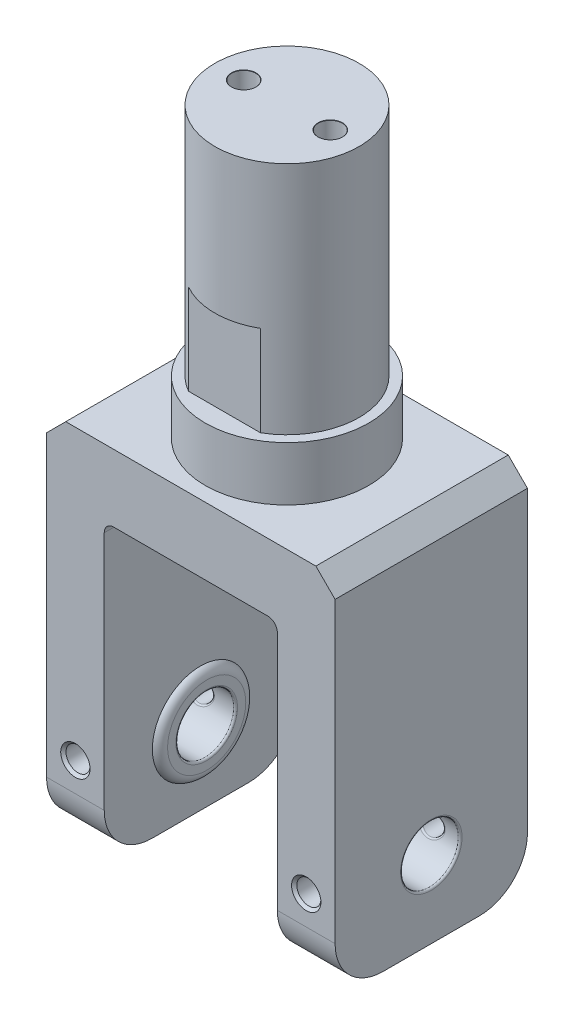
from build123d import *

# Parameters (mm, degrees)
SKETCH_1_W                   = 30
SKETCH_1_H                   = 20
EXTRUDE_1_DEPTH              = 40
SKETCH_2_W                   = 18
SKETCH_2_H                   = 34
CUT_EXTRUDE_1_DEPTH          = 48.16990566
SKETCH_3_R                   = 3
CUT_EXTRUDE_2_DEPTH          = 51.990195136
CHAMFER_1_SIZE               = 2
CHAMFER_2_SIZE               = 1
FILLET_1_R                   = 1
EXTRUDE_START                = 0.65
SKETCH_4_R                   = 5
SKETCH_4_R_2                 = 3
EXTRUDE_2_DEPTH              = 0.65
FILLET_2_R                   = 1
FILLET_2_OF_MIRROR_1_R       = 1
SKETCH_5_R                   = 8.5
EXTRUDE_3_DEPTH              = 5.62
SKETCH_6_R                   = 7.5
EXTRUDE_4_DEPTH              = 24.4
HOLE_WIZARD_M3_1_D           = 2.5
HOLE_WIZARD_M3_1_CSINK_D     = 3.05
HOLE_WIZARD_M3_1_CSINK_ANGLE = 90
F_2_5MM_1_D                  = 2.5
F_2_5MM_1_DEPTH              = 8.5
F_2_5MM_1_CSINK_D            = 2.55
F_2_5MM_1_CSINK_ANGLE        = 90
F_2_5MM_1_TIP                = 0.751075774
FILLET_3_R                   = 0.2
CUT_EXTRUDE_START            = -15
SKETCH_13_W                  = 1.859245168
SKETCH_13_H                  = 11.127950351
SKETCH_13_W_2                = 13.010312946
SKETCH_13_H_2                = 5.756908727
CUT_EXTRUDE_3_DEPTH          = 9.4
SKETCH_14_W                  = 47.057083946
SKETCH_14_H                  = 7
CUT_EXTRUDE_4_DEPTH          = 75.349178879
FILLET_5_R                   = 5


with BuildPart() as part:
    # 草图1 → 凸台-拉伸1 (new body)
    with BuildSketch(Plane(origin=(0, 0, 0), x_dir=(1, 0, 0), z_dir=(0, 1, 0))):
        Rectangle(SKETCH_1_W, SKETCH_1_H)
    extrude(amount=EXTRUDE_1_DEPTH)

    # 草图2 → 切除-拉伸1 (cut, through all)
    with BuildSketch(Plane.XY.offset(10)):
        with Locations((0, 16)):
            Rectangle(SKETCH_2_W, SKETCH_2_H)
    extrude(amount=-CUT_EXTRUDE_1_DEPTH, mode=Mode.SUBTRACT)

    # 草图3 → 切除-拉伸2 (cut, through all)
    with BuildSketch(Plane(origin=(15, 0, 0), x_dir=(0, 0, -1), z_dir=(1, 0, 0))):
        with Locations((0, 10)):
            Circle(SKETCH_3_R)
    extrude(amount=-CUT_EXTRUDE_2_DEPTH, mode=Mode.SUBTRACT)

    # 倒角1
    chamfer_1_edges = [part.edges().sort_by_distance(p)[0] for p in [
        (-15, 40, 0),
        (15, 40, 0),
    ]]
    chamfer(chamfer_1_edges, length=CHAMFER_1_SIZE)

    # 倒角2
    chamfer_2_edges = [part.edges().sort_by_distance(p)[0] for p in [
        (9, 0, 0),
        (-9, 0, 0),
        (-15, 0, 0),
        (15, 0, 0),
    ]]
    chamfer(chamfer_2_edges, length=CHAMFER_2_SIZE)

    # 圆角1
    fillet_1_edges = [part.edges().sort_by_distance(p)[0] for p in [
        (-9, 33, 0),
        (9, 33, 0),
    ]]
    fillet(fillet_1_edges, radius=FILLET_1_R)

    # 草图4 → 凸台-拉伸2 (add)
    with BuildSketch(Plane(origin=(-9, 0, 0), x_dir=(0, 0, -1), z_dir=(1, 0, 0)).offset(EXTRUDE_START)):
        with Locations(Location((0, 10, 0), (0, 0, 270))):
            Circle(SKETCH_4_R)
        with Locations((0, 10)):
            Circle(SKETCH_4_R_2, mode=Mode.SUBTRACT)
    extrude_2 = extrude(amount=-EXTRUDE_2_DEPTH)

    # 圆角2
    # the kernel refuses this fillet: 1 mm, written as the material it takes off along each edge
    with BuildSketch(Plane(origin=(-8.35, 10, 0), x_dir=(0, -1, 0), z_dir=(0, 0, 1))) as fillet_2_piece_1:
        with BuildLine():
            CenterArc((4.0632503, -1), FILLET_2_R, 20.487315115, 69.512684885)
            Line((5, -0.65), (5.018734994, -0.643))
            ThreePointArc((5.018734994, -0.643), (5.02, -0.325), (5.02, 0))
            Line((5.02, 0), (5, 0.02))
            Line((5, 0.02), (4.0632503, 0.02))
            Line((4.0632503, 0.02), (4.0632503, 0))
        make_face()
    revolve(axis=Axis((-8.35, 10, 0), (1, 0, 0)), mode=Mode.SUBTRACT)

    # 镜向1: 凸台-拉伸2 across plane
    add(extrude_2.mirror(Plane(origin=(0, 0, 0), x_dir=(0, 0, 1), z_dir=(1, 0, 0))))

    # 圆角2 of 镜向1
    # the kernel refuses this fillet: 1 mm, written as the material it takes off along each edge
    with BuildSketch(Plane(origin=(8.35, 10, 0), x_dir=(0, -1, 0), z_dir=(0, 0, 1))) as fillet_2_of_mirror_1_piece_1:
        with BuildLine():
            CenterArc((4.0632503, 1), FILLET_2_OF_MIRROR_1_R, 270, 69.512684885)
            Line((5, 0.65), (5.018734994, 0.643))
            ThreePointArc((5.018734994, 0.643), (5.02, 0.325), (5.02, 0))
            Line((5.02, 0), (5, -0.02))
            Line((5, -0.02), (4.0632503, -0.02))
            Line((4.0632503, -0.02), (4.0632503, 0))
        make_face()
    revolve(axis=Axis((8.35, 10, 0), (1, 0, 0)), mode=Mode.SUBTRACT)

    # 草图5 → 凸台-拉伸3 (add)
    with BuildSketch(Plane(origin=(0, 40, 0), x_dir=(1, 0, 0), z_dir=(0, 1, 0))):
        with Locations(Location((0, 0, 0), (0, 0, 270))):
            Circle(SKETCH_5_R)
    extrude(amount=EXTRUDE_3_DEPTH)

    # 草图6 → 凸台-拉伸4 (add)
    with BuildSketch(Plane(origin=(0, 45.62, 0), x_dir=(1, 0, 0), z_dir=(0, 1, 0))):
        with Locations(Location((0, 0, 0), (0, 0, 270))):
            Circle(SKETCH_6_R)
    extrude(amount=EXTRUDE_4_DEPTH)

    # M3 螺纹孔1 (through all)
    with Locations(Plane.XY.offset(10)):
        with Locations((-12, 10), (12, 10)):
            CounterSinkHole(HOLE_WIZARD_M3_1_D / 2, HOLE_WIZARD_M3_1_CSINK_D / 2, counter_sink_angle=HOLE_WIZARD_M3_1_CSINK_ANGLE)

    # Ø2.5mm 暗销孔1
    with Locations(Plane(origin=(4.5, 70.02, 0), x_dir=(0, 0, 1), z_dir=(0, 1, 0))):
        with Locations((0, 0), (0, -9)):
            CounterSinkHole(F_2_5MM_1_D / 2, F_2_5MM_1_CSINK_D / 2, depth=F_2_5MM_1_DEPTH, counter_sink_angle=F_2_5MM_1_CSINK_ANGLE)
            with Locations((0, 0, -(F_2_5MM_1_DEPTH + F_2_5MM_1_TIP / 2))):  # 118° drill point
                Cone(0, F_2_5MM_1_D / 2, F_2_5MM_1_TIP, mode=Mode.SUBTRACT)

    # 圆角3
    fillet_3_edges = [part.edges().sort_by_distance(p)[0] for p in [
        (-8.35, 10, 3),
        (8.35, 10, 3),
        (12, 8.75, -2.727178029),
        (13.250000001, 10, 3.000000001),
        (-12, 8.75, -2.727178029),
        (-10.749999999, 10, 3.000000001),
        (-15, 10, 3),
        (15, 10, 3),
    ]]
    fillet(fillet_3_edges, radius=FILLET_3_R)

    # 草图13 → 切除-拉伸3 (cut)
    with BuildSketch(Plane(origin=(0, 70.02, 0), x_dir=(1, 0, 0), z_dir=(0, 1, 0)).offset(CUT_EXTRUDE_START)):
        with Locations((-7.429622584, 0.075530932)):
            Rectangle(SKETCH_13_W, SKETCH_13_H)
        with Locations((0.374562656, -9.378454364)):
            Rectangle(SKETCH_13_W_2, SKETCH_13_H_2)
    extrude(amount=-CUT_EXTRUDE_3_DEPTH, mode=Mode.SUBTRACT)

    # 草图14 → 切除-拉伸4 (cut, through all)
    with BuildSketch(Plane(origin=(0, 0, -10), x_dir=(-1, 0, 0), z_dir=(0, 0, -1))):
        with Locations((1.402663079, -1.5)):
            Rectangle(SKETCH_14_W, SKETCH_14_H)
    extrude(amount=-CUT_EXTRUDE_4_DEPTH, mode=Mode.SUBTRACT)

    # 圆角5
    fillet_5_edges = [part.edges().sort_by_distance(p)[0] for p in [
        (-12, 2, 10),
        (12, 2, 10),
        (12, 2, -10),
        (-12, 2, -10),
    ]]
    fillet(fillet_5_edges, radius=FILLET_5_R)


solid = part.part
